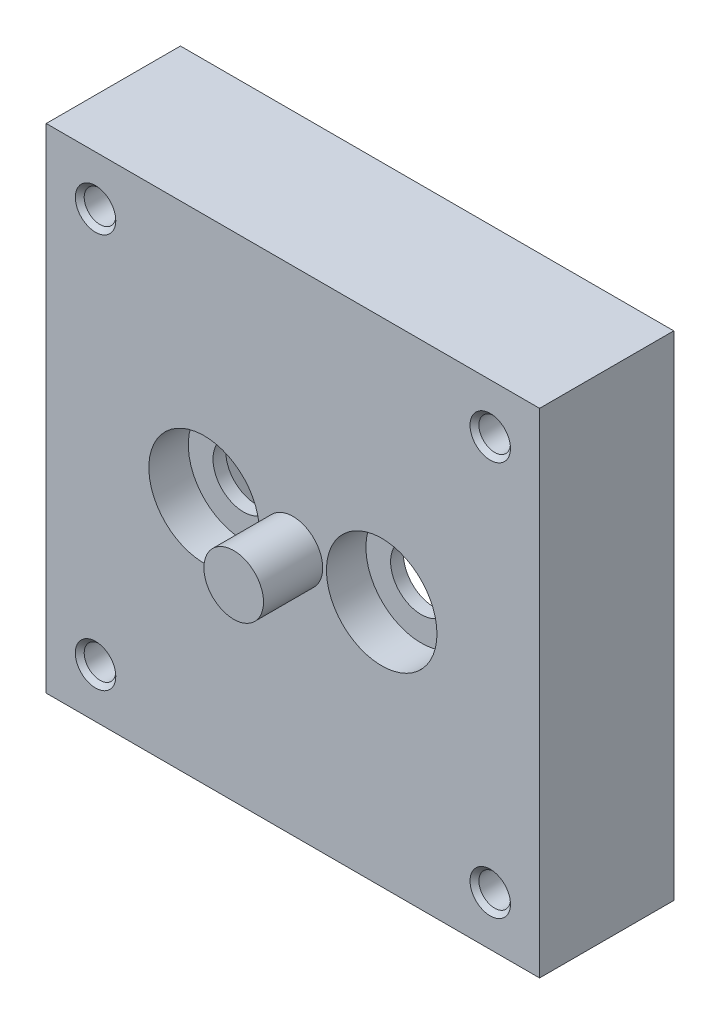
from build123d import *

# Parameters (mm, degrees)
SKETCH_1_W                   = 25
SKETCH_1_H                   = 25
SKETCH_1_R                   = 1.5
EXTRUDE_1_DEPTH              = 7.65
SKETCH_2_R                   = 1.51
EXTRUDE_2_DEPTH              = 3
SKETCH_3_R                   = 7.5
CUT_EXTRUDE_1_DEPTH          = 5
SKETCH_4_R                   = 2.8
CUT_EXTRUDE_2_DEPTH          = 2
SKETCH_5_R                   = 1.55
CUT_EXTRUDE_3_DEPTH          = 2
SKETCH_6_W                   = 7.593154143
SKETCH_6_H                   = 30.65177665
CUT_EXTRUDE_4_DEPTH          = 30.911076544
EXTRUDE_START                = 0.5
SKETCH_7_R                   = 10
SKETCH_7_R_2                 = 7.5
EXTRUDE_3_DEPTH              = 0.5
FILLET_4_R                   = 2
HOLE_WIZARD_M2_1_D           = 1.6
HOLE_WIZARD_M2_1_CSINK_D     = 2.05
HOLE_WIZARD_M2_1_CSINK_ANGLE = 90


with BuildPart() as part:
    # 草图1 → 凸台-拉伸1 (new body)
    # profile 1 of 2: a face of its own
    with BuildSketch(Plane.XY):
        Rectangle(SKETCH_1_W, SKETCH_1_H)
        Circle(SKETCH_1_R, mode=Mode.SUBTRACT)
    # profile 2 of 2: a face of its own
    with BuildSketch(Plane.XY):
        Circle(SKETCH_1_R)
    extrude(amount=EXTRUDE_1_DEPTH)

    # 草图2 → 凸台-拉伸2 (add)
    with BuildSketch(Plane.XY.offset(7.65)):
        Circle(SKETCH_2_R)
    extrude(amount=EXTRUDE_2_DEPTH)

    # 草图3 → 切除-拉伸1 (cut)
    with BuildSketch(Plane(origin=(0, 0, 0), x_dir=(-1, 0, 0), z_dir=(0, 0, -1))):
        Circle(SKETCH_3_R)
    extrude(amount=-CUT_EXTRUDE_1_DEPTH, mode=Mode.SUBTRACT)

    # 草图4 → 切除-拉伸2 (cut)
    with BuildSketch(Plane.XY.offset(7.65)):
        with Locations((4.5, 0)):
            Circle(SKETCH_4_R)
        with Locations((-4.5, 0)):
            Circle(SKETCH_4_R)
    extrude(amount=-CUT_EXTRUDE_2_DEPTH, mode=Mode.SUBTRACT)

    # 草图5 → 切除-拉伸3 (cut)
    with BuildSketch(Plane.XY.offset(5.65)):
        with Locations((4.5, 0)):
            Circle(SKETCH_5_R)
        with Locations((-4.5, 0)):
            Circle(SKETCH_5_R)
    extrude(amount=-CUT_EXTRUDE_3_DEPTH, mode=Mode.SUBTRACT)

    # 草图6 → 切除-拉伸4 (cut, through all)
    with BuildSketch(Plane.ZY.offset(12.5)):
        with Locations((-2.946577072, 0.223328063)):
            Rectangle(SKETCH_6_W, SKETCH_6_H)
    extrude(amount=-CUT_EXTRUDE_4_DEPTH, mode=Mode.SUBTRACT)

    # 草图7 → 凸台-拉伸3 (add)
    with BuildSketch(Plane(origin=(0, 0, 0.85), x_dir=(-1, 0, 0), z_dir=(0, 0, -1)).offset(EXTRUDE_START)):
        with Locations(Location((0, 0, 0), (0, 0, 90))):
            Circle(SKETCH_7_R)
        Circle(SKETCH_7_R_2, mode=Mode.SUBTRACT)
    extrude(amount=-EXTRUDE_3_DEPTH)

    # 圆角4
    # the kernel refuses this fillet: 2 mm, written as the material it adds along each edge
    with BuildSketch(Plane(origin=(0, 0, 0.85), x_dir=(0, 1, 0), z_dir=(-1, 0, 0))) as fillet_4_piece_1:
        with BuildLine():
            CenterArc((11.322875656, 2), FILLET_4_R, 228.590377891, 41.409622109)
            Line((11.322875656, 0), (11.322875656, -0.04))
            Line((11.322875656, -0.04), (10, -0.04))
            Line((10, -0.04), (9.96, 0))
            ThreePointArc((9.96, 0), (9.96, 0.25), (9.973542487, 0.47))
            Line((9.973542487, 0.47), (10, 0.5))
        make_face()
    revolve(axis=Axis((0, 0, 0.85), (0, 0, -1)))

    # M2 螺纹孔1 (through all)
    with Locations(Plane.XY.offset(7.65)):
        with Locations((-10, 10), (10, 10), (-10, -10), (10, -10)):
            CounterSinkHole(HOLE_WIZARD_M2_1_D / 2, HOLE_WIZARD_M2_1_CSINK_D / 2, counter_sink_angle=HOLE_WIZARD_M2_1_CSINK_ANGLE)


solid = part.part
